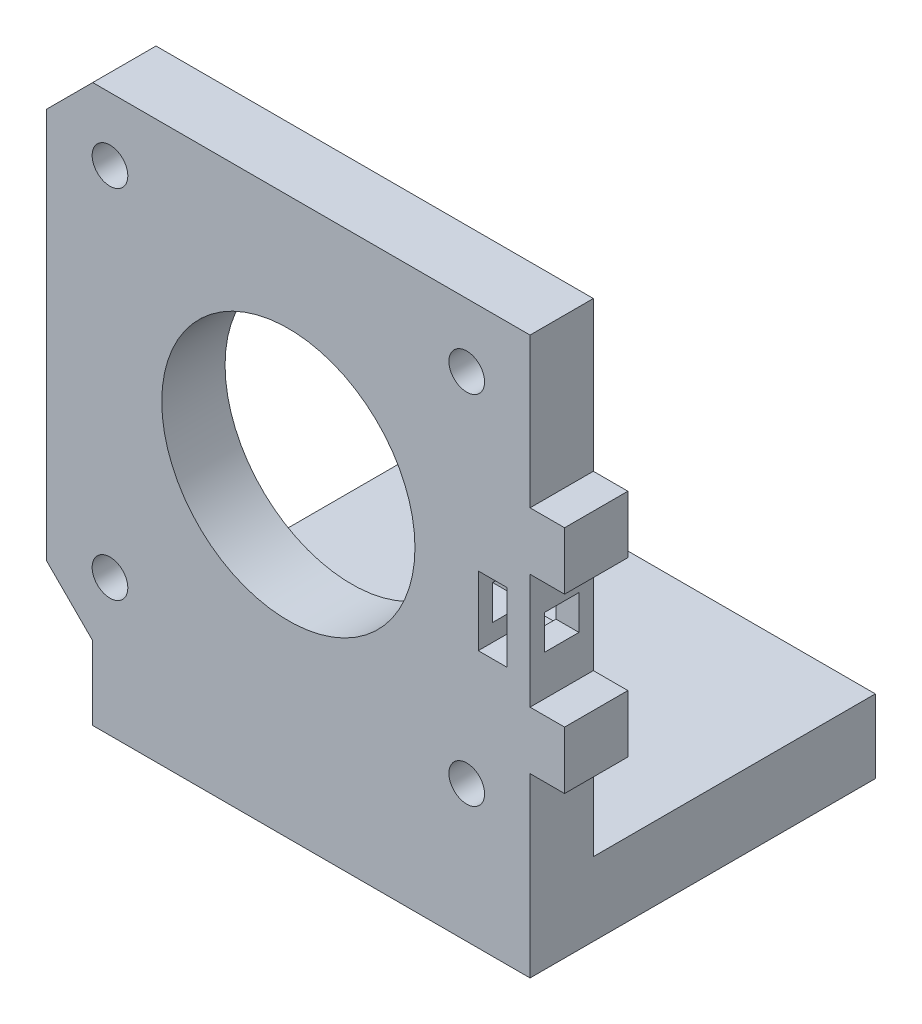
from build123d import *

# Parameters (mm, degrees)
CROQUIS1_R              = 1.55
CROQUIS1_R_2            = 11
SALIENTE_EXTRUIR1_DEPTH = 5.5
CROQUIS2_W              = 38
CROQUIS2_H              = 6.38
SALIENTE_EXTRUIR2_DEPTH = 30
CROQUIS3_W              = 5.5
CROQUIS3_H              = 5
SALIENTE_EXTRUIR3_DEPTH = 3
CROQUIS6_W              = 3
CROQUIS6_H              = 3
CORTAR_EXTRUIR2_DEPTH   = 8
CROQUIS7_W              = 2.5
CROQUIS7_H              = 6
CORTAR_EXTRUIR3_DEPTH   = 69.476273263


with BuildPart() as part:
    # Croquis1 → Saliente-Extruir1 (new body)
    with BuildSketch(Plane.XY):
        Polygon((0, 38), (0, 4), (4, 0), (42, 0), (42, 42), (4, 42), align=None)
        with Locations((5.5, 5.5)):
            Circle(CROQUIS1_R, mode=Mode.SUBTRACT)
        with Locations((36.5, 5.5)):
            Circle(CROQUIS1_R, mode=Mode.SUBTRACT)
        with Locations((21, 21)):
            Circle(CROQUIS1_R_2, mode=Mode.SUBTRACT)
        with Locations((5.5, 36.5)):
            Circle(CROQUIS1_R, mode=Mode.SUBTRACT)
        with Locations((36.5, 36.5)):
            Circle(CROQUIS1_R, mode=Mode.SUBTRACT)
    extrude(amount=SALIENTE_EXTRUIR1_DEPTH)

    # Croquis2 → Saliente-Extruir2 (add)
    with BuildSketch(Plane.XY.offset(5.5)):
        with Locations((23, -3.19)):
            Rectangle(CROQUIS2_W, CROQUIS2_H)
    extrude(amount=-SALIENTE_EXTRUIR2_DEPTH)

    # Croquis3 → Saliente-Extruir3 (add)
    with BuildSketch(Plane(origin=(42, 0, 0), x_dir=(0, 0, -1), z_dir=(1, 0, 0))):
        with Locations((-2.75, 26.5)):
            Rectangle(CROQUIS3_W, CROQUIS3_H)
        with Locations((-2.75, 11.5)):
            Rectangle(CROQUIS3_W, CROQUIS3_H)
    extrude(amount=SALIENTE_EXTRUIR3_DEPTH)

    # Croquis6 → Cortar-Extruir2 (cut)
    with BuildSketch(Plane(origin=(42, 0, 0), x_dir=(0, 0, -1), z_dir=(1, 0, 0))):
        with Locations((-2.75, 19)):
            Rectangle(CROQUIS6_W, CROQUIS6_H)
    extrude(amount=-CORTAR_EXTRUIR2_DEPTH, mode=Mode.SUBTRACT)

    # Croquis7 → Cortar-Extruir3 (cut, through all)
    with BuildSketch(Plane.XY.offset(5.5)):
        with Locations((38.75, 19)):
            Rectangle(CROQUIS7_W, CROQUIS7_H)
    extrude(amount=-CORTAR_EXTRUIR3_DEPTH, mode=Mode.SUBTRACT)


solid = part.part
